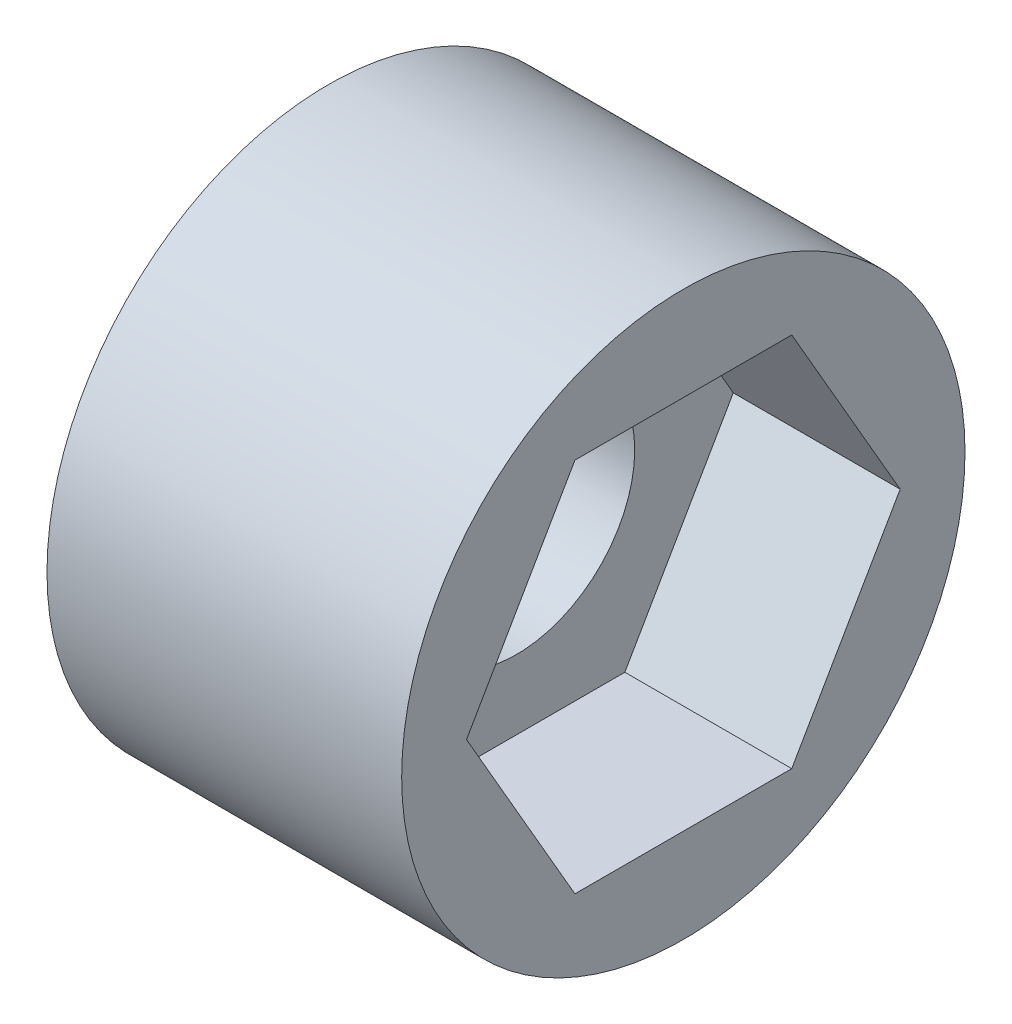
from build123d import *

# Parameters (mm, degrees)
SKETCH1_R           = 9.525
BOSS_EXTRUDE1_DEPTH = 11.993992776
SKETCH2_R           = 4
BOSS_EXTRUDE2_DEPTH = 6.35


with BuildPart() as part:
    # Sketch1 → Boss-Extrude1 (new body)
    with BuildSketch(Plane(origin=(0, 0, 0), x_dir=(0, 0, -1), z_dir=(1, 0, 0))):
        Circle(SKETCH1_R)
        Polygon((7.332348419, 0), (3.666174209, 6.35), (-3.666174209, 6.35), (-7.332348419, 0), (-3.666174209, -6.35), (3.666174209, -6.35), align=None, mode=Mode.SUBTRACT)
    extrude(amount=BOSS_EXTRUDE1_DEPTH)

    # Sketch2 → Boss-Extrude2 (add)
    with BuildSketch(Plane.ZY):
        Polygon((7.332348419, 0), (3.666174209, 6.35), (-3.666174209, 6.35), (-7.332348419, 0), (-3.666174209, -6.35), (3.666174209, -6.35), align=None)
        Circle(SKETCH2_R, mode=Mode.SUBTRACT)
    extrude(amount=-BOSS_EXTRUDE2_DEPTH)


solid = part.part
